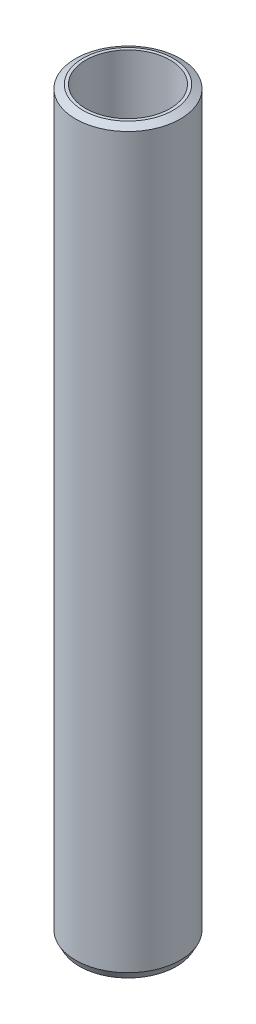
from build123d import *
from OCP.BRepFilletAPI import BRepFilletAPI_MakeChamfer

# Parameters (mm, degrees)
SKETCH1_R           = 42.5
BOSS_EXTRUDE1_DEPTH = 600
SKETCH2_R           = 34.178594084
CUT_EXTRUDE1_DEPTH  = 604.002902149
CHAMFER1_SIZE       = 3.142426163
CHAMFER1_SIZE2      = 5.917999094


with BuildPart() as part:
    # Sketch1 → Boss-Extrude1 (new body)
    with BuildSketch(Plane(origin=(0, 0, 0), x_dir=(1, 0, 0), z_dir=(0, 1, 0))):
        Circle(SKETCH1_R)
    extrude(amount=BOSS_EXTRUDE1_DEPTH)

    # Sketch2 → Cut-Extrude1 (cut, through all)
    with BuildSketch(Plane(origin=(0, 0, 0), x_dir=(1, 0, 0), z_dir=(0, 1, 0))):
        Circle(SKETCH2_R)
    extrude(amount=CUT_EXTRUDE1_DEPTH, mode=Mode.SUBTRACT)

    # Chamfer1: one chamfer whose edges measure the first distance from different faces: ONE call of the kernel's chamfer builder (chamfer() names one face for all edges)
    chamfer1_edges_1 = [part.edges().sort_by_distance(p)[0] for p in [
        (-42.5, 600, 0),
    ]]
    chamfer1_side_1 = [part.faces().sort_by_distance(p)[0] for p in [
        (-42.5, 300, 0),
    ]]
    chamfer1_edges_2 = [part.edges().sort_by_distance(p)[0] for p in [
        (-42.5, 0, 0),
    ]]
    chamfer1_side_2 = [part.faces().sort_by_distance(p)[0] for p in [
        (-41.297918472, 0, 0),
    ]]
    chamfer1 = BRepFilletAPI_MakeChamfer(part.part.solid().wrapped)
    for e in chamfer1_edges_1:
        chamfer1.Add(CHAMFER1_SIZE, CHAMFER1_SIZE2, e.wrapped, chamfer1_side_1[0].wrapped)  # the first distance lies on this face
    for e in chamfer1_edges_2:
        chamfer1.Add(CHAMFER1_SIZE, CHAMFER1_SIZE2, e.wrapped, chamfer1_side_2[0].wrapped)  # the first distance lies on this face
    add(Compound.cast(chamfer1.Shape()), mode=Mode.REPLACE)


solid = part.part
